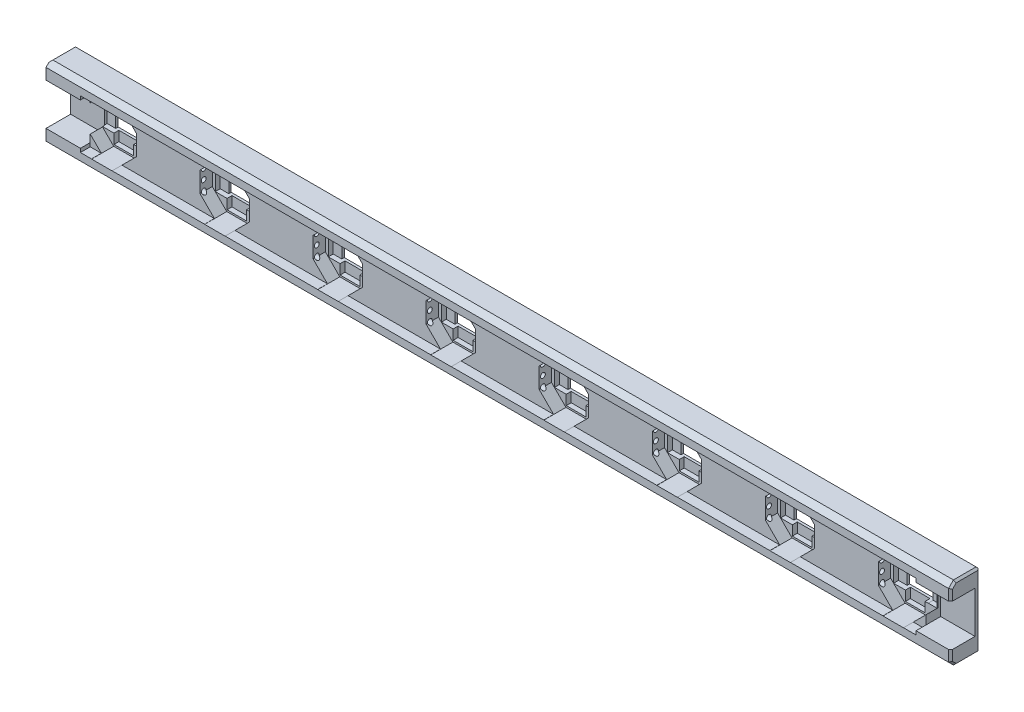
from build123d import *

# Parameters (mm, degrees)
SKETCH1_W                = 184
SKETCH1_H                = 15
BOSS_EXTRUDE1_DEPTH      = 6
CUT_EXTRUDE8_DEPTH       = 184
SKETCH13_W               = 0.5
SKETCH13_H               = 10
CUT_EXTRUDE9_DEPTH       = 0.6
FILLET1_R                = 0.25
FILLET2_R                = 0.25
CHAMFER1_SIZE            = 0.4
CHAMFER2_SIZE            = 0.4
CHAMFER3_SIZE            = 0.4
CHAMFER5_SIZE            = 0.4
CUT_EXTRUDE10_DEPTH      = 4.5
SKETCH16_W               = 5.3
SKETCH16_H               = 5.3
CUT_EXTRUDE11_DEPTH      = 4.5
SKETCH17_W               = 4
SKETCH17_H               = 2
CUT_EXTRUDE12_DEPTH      = 1
SKETCH18_W               = 1.75
SKETCH18_H               = 5.318073247
SKETCH18_H_2             = 5.281926753
CUT_EXTRUDE13_DEPTH      = 1
LPATTERN1_COUNT          = 8
LPATTERN1_PITCH          = 23
SKETCH19_W               = 7
SKETCH19_H               = 8.5
CUT_EXTRUDE14_DEPTH      = 5
SKETCH20_W               = 170
SKETCH20_H               = 10
CUT_EXTRUDE15_DEPTH      = 2
CUT_EXTRUDE16_DEPTH      = 112.8161514
CUT_EXTRUDE16_DEPTH_BACK = 112.8161514
SKETCH21_R               = 0.5


with BuildPart() as part:
    # Sketch1 → Boss-Extrude1 (new body)
    with BuildSketch(Plane.XY):
        with Locations((-45.75, 18.154296875)):
            Rectangle(SKETCH1_W, SKETCH1_H)
    extrude(amount=BOSS_EXTRUDE1_DEPTH)

    # Sketch12 → Cut-Extrude8 (cut)
    with BuildSketch(Plane(origin=(46.25, 0, 0), x_dir=(0, 0, -1), z_dir=(1, 0, 0))):
        Polygon((-6, 25.654296875), (-6, 24.654296875), (-5, 25.654296875), align=None)
        Polygon((-6, 10.654296875), (-5, 10.654296875), (-6, 11.654296875), align=None)
    extrude(amount=-CUT_EXTRUDE8_DEPTH, mode=Mode.SUBTRACT)

    # Sketch13 → Cut-Extrude9 (cut)
    with BuildSketch(Plane(origin=(0, 0, 0), x_dir=(-1, 0, 0), z_dir=(0, 0, -1))):
        with Locations((135.5, 18.154296875)):
            Rectangle(SKETCH13_W, SKETCH13_H)
    extrude(amount=-CUT_EXTRUDE9_DEPTH, mode=Mode.SUBTRACT)

    # Fillet1
    fillet1_edges = [part.edges().sort_by_distance(p)[0] for p in [
        (-135.75, 18.154296875, 0),
    ]]
    fillet(fillet1_edges, radius=FILLET1_R)

    # Fillet2
    fillet2_edges = [part.edges().sort_by_distance(p)[0] for p in [
        (-135.25, 18.154296875, 0.6),
        (-135.5, 23.154296875, 0.6),
        (-135.75, 18.154296875, 0.6),
        (-135.5, 13.154296875, 0.6),
    ]]
    fillet(fillet2_edges, radius=FILLET2_R - 0.0001)  # a hair under: the kernel refuses the full size

    # Chamfer1
    chamfer1_edges = [part.edges().sort_by_distance(p)[0] for p in [
        (-45.75, 25.654296875, 0),
        (-45.75, 10.654296875, 0),
    ]]
    chamfer(chamfer1_edges, length=CHAMFER1_SIZE)

    # Chamfer2
    chamfer2_edges = [part.edges().sort_by_distance(p)[0] for p in [
        (46.25, 18.154296875, 0),
        (-137.75, 18.154296875, 0),
    ]]
    chamfer(chamfer2_edges, length=CHAMFER2_SIZE)

    # Chamfer3
    chamfer3_edges = [part.edges().sort_by_distance(p)[0] for p in [
        (-137.75, 25.654296875, 2.7),
        (-137.75, 10.654296875, 2.7),
    ]]
    chamfer(chamfer3_edges, length=CHAMFER3_SIZE)

    # Chamfer5
    chamfer5_edges = [part.edges().sort_by_distance(p)[0] for p in [
        (46.25, 18.154296875, 6),
        (46.25, 25.654296875, 2.7),
        (46.25, 10.654296875, 2.7),
        (46.25, 25.154296875, 5.5),
        (46.25, 11.154296875, 5.5),
    ]]
    chamfer(chamfer5_edges, length=CHAMFER5_SIZE)

    # Sketch15 → Cut-Extrude10 (cut)
    with BuildSketch(Plane.XY.offset(6)):
        Polygon((-121.382117138, 20.232772011), (-124.321524864, 23.172179737), (-128.478475136, 23.172179737), (-131.417882862, 20.232772011), (-131.417882862, 16.075821739), (-128.478475136, 13.136414013), (-124.321524864, 13.136414013), (-121.382117138, 16.075821739), align=None)
    cut_extrude10 = extrude(amount=-CUT_EXTRUDE10_DEPTH, mode=Mode.SUBTRACT)

    # Sketch16 → Cut-Extrude11 (cut)
    with BuildSketch(Plane.XY.offset(1.5)):
        with Locations((-126.417882862, 18.136414013)):
            Rectangle(SKETCH16_W, SKETCH16_H)
    cut_extrude11 = extrude(amount=-CUT_EXTRUDE11_DEPTH, mode=Mode.SUBTRACT)

    # Sketch17 → Cut-Extrude12 (cut)
    with BuildSketch(Plane.XY.offset(1.5)):
        with Locations((-126.417882862, 14.486414013)):
            Rectangle(SKETCH17_W, SKETCH17_H)
        with Locations((-126.417882862, 21.786414013)):
            Rectangle(SKETCH17_W, SKETCH17_H)
    cut_extrude12 = extrude(amount=-CUT_EXTRUDE12_DEPTH, mode=Mode.SUBTRACT)

    # Sketch18 → Cut-Extrude13 (cut)
    with BuildSketch(Plane.XY.offset(1.5)):
        with Locations((-129.942882862, 18.145450637)):
            Rectangle(SKETCH18_W, SKETCH18_H)
        with Locations((-122.892882862, 18.145450637)):
            Rectangle(SKETCH18_W, SKETCH18_H_2)
    cut_extrude13 = extrude(amount=-CUT_EXTRUDE13_DEPTH, mode=Mode.SUBTRACT)

    # LPattern1: Cut-Extrude10, Cut-Extrude11, Cut-Extrude12, Cut-Extrude13 ×8
    with Locations(*[(i * LPATTERN1_PITCH, 0, 0) for i in range(1, LPATTERN1_COUNT)]):
        add(cut_extrude10, mode=Mode.SUBTRACT)
        add(cut_extrude11, mode=Mode.SUBTRACT)
        add(cut_extrude12, mode=Mode.SUBTRACT)
        add(cut_extrude13, mode=Mode.SUBTRACT)

    # Sketch19 → Cut-Extrude14 (cut)
    with BuildSketch(Plane.XY.offset(6)):
        with Locations((-134.25, 18.154296875)):
            Rectangle(SKETCH19_W, SKETCH19_H)
        with Locations((42.75, 18.154296875)):
            Rectangle(SKETCH19_W, SKETCH19_H)
    extrude(amount=-CUT_EXTRUDE14_DEPTH, mode=Mode.SUBTRACT)

    # Sketch20 → Cut-Extrude15 (cut)
    with BuildSketch(Plane.XY.offset(6)):
        with Locations((-45.75, 18.154296875)):
            Rectangle(SKETCH20_W, SKETCH20_H)
    extrude(amount=-CUT_EXTRUDE15_DEPTH, mode=Mode.SUBTRACT)

    # Sketch21 → Cut-Extrude16 (cut, two sides: drawn at the far end of the back side and taken through both)
    with BuildSketch(Plane(origin=(-62.417882862, 0, 0), x_dir=(0, 0, -1), z_dir=(1, 0, 0)).offset(-CUT_EXTRUDE16_DEPTH_BACK)):
        with Locations(Location((-3.25, 18.162772011, 0), (0, 0, 180))):
            Circle(SKETCH21_R)
        with Locations(Location((-3.25, 20.162772011, 0), (0, 0, 171.952153753))):
            Circle(SKETCH21_R)
        with Locations(Location((-3.25, 16.162772011, 0), (0, 0, 190.014682892))):
            Circle(SKETCH21_R)
    extrude(amount=CUT_EXTRUDE16_DEPTH + CUT_EXTRUDE16_DEPTH_BACK, mode=Mode.SUBTRACT)


solid = part.part
